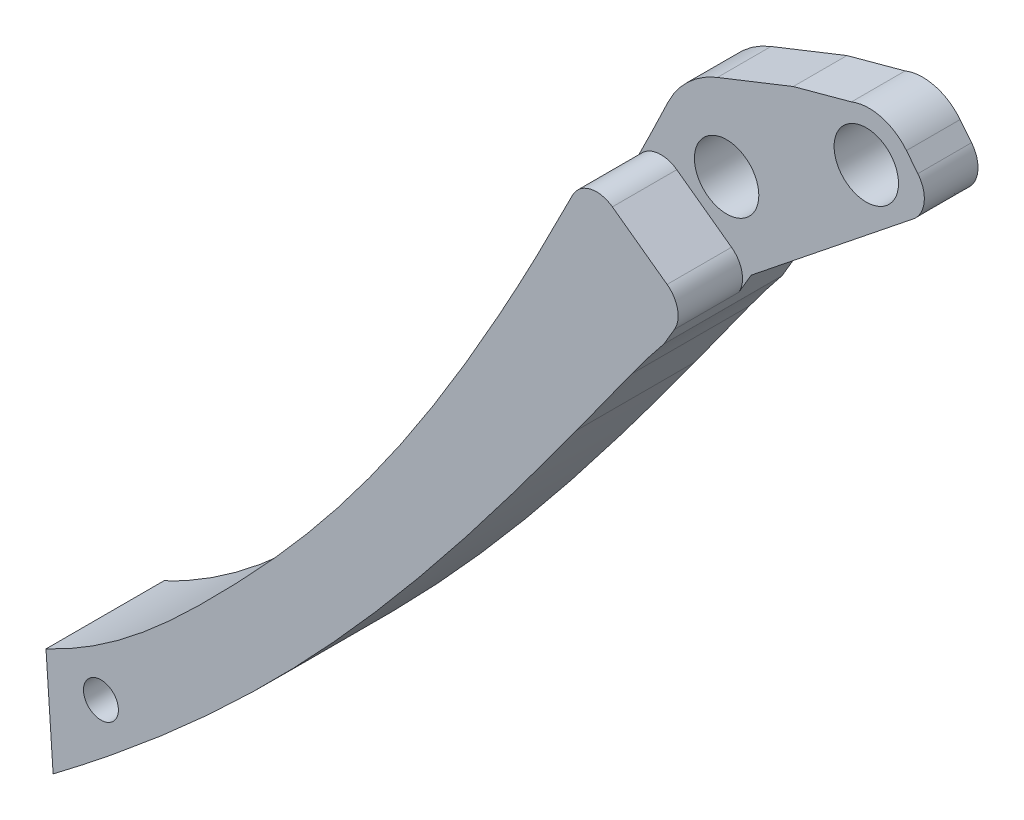
from build123d import *

# Parameters (mm, degrees)
SKETCH_1_R              = 3.25
SKETCH_1_R_2            = 2.6
SKETCH_1_R_3            = 6
EXTRUDE_1_DEPTH         = 22
CUT_EXTRUDE_START       = -12
CUT_EXTRUDE_1_OUTLINE_R = 6
CUT_EXTRUDE_1_DEPTH     = 12
FILLET_1_R              = 5


# Read off the part's stored shape, not the designer's step: 切除-拉伸1
with BuildPart() as part:
    # 草图1 → 凸台-拉伸1 (new body)
    # profile 1 of 5: a face of its own
    with BuildSketch(Plane.XY):
        with BuildLine():
            add(Edge.make_bspline(
                [(24.246770742, 21.941390991), (24.048583333, 21.634147277), (23.849915374, 21.32721218), (19.701623041, 14.940432485), (15.559132392, 8.986031396), (8.996184749, 0.316151178), (6.750767703, -2.530392197), (2.144057051, -8.127411356), (-0.217808171, -10.878282604), (-5.046422661, -16.285033431), (-7.513766191, -18.941614921), (-11.275529005, -22.867124427), (-12.539552784, -24.166218208), (-15.083673792, -26.748249579), (-16.36301535, -28.031904747), (-20.240592162, -31.842886453), (-22.879147648, -34.331371146), (-28.34991894, -39.09038887), (-31.182503177, -41.360621491), (-37.102725457, -45.547224242), (-40.191371338, -47.46215102), (-44.265140387, -49.576428538), (-45.130202316, -50.003144372), (-46.003788403, -50.411640151)],
                knots=[0.243696274, 0.243696274, 0.243696274, 0.243696274, 0.25, 0.25, 0.375, 0.375, 0.4375, 0.4375, 0.5, 0.5, 0.5625, 0.5625, 0.59375, 0.59375, 0.625, 0.625, 0.6875, 0.6875, 0.75, 0.75, 0.8125, 0.8125, 0.829122533, 0.829122533, 0.829122533, 0.829122533], degree=3))
            Line((-46.003788403, -50.411640151), (-44.676128402, -69.924811579))
            add(Edge.make_bspline(
                [(-44.676128402, -69.924811579), (-42.354879029, -68.173560917), (-40.052239479, -66.397657245), (-31.894879431, -59.96761332), (-26.146670204, -55.177399813), (-14.945706379, -45.263165822), (-9.496217193, -40.135747192), (1.08076509, -29.558238094), (6.20766625, -24.108720133), (16.162933512, -12.943513517), (20.991776432, -7.229875688), (25.744132469, -1.370589693), (25.785083216, -1.320082664), (25.826025181, -1.269568576)],
                knots=[0.201401882, 0.201401882, 0.201401882, 0.201401882, 0.25, 0.25, 0.375, 0.375, 0.5, 0.5, 0.625, 0.625, 0.75, 0.75, 0.751086715, 0.751086715, 0.751086715, 0.751086715], degree=3))
            Line((25.826025181, -1.269568576), (24.246770742, 21.941390991))
        make_face()
        with Locations((-35.768456318, -53.530610672)):
            Circle(SKETCH_1_R, mode=Mode.SUBTRACT)
        with Locations((15.866025181, -2.197268261)):
            Circle(SKETCH_1_R_2, mode=Mode.SUBTRACT)
    # profile 2 of 5: a face of its own
    with BuildSketch(Plane.XY):
        with BuildLine():
            add(Edge.make_bspline(
                [(45.404726147, 58.671213746), (42.047127081, 52.245521431), (38.580985934, 45.876195201), (31.539947217, 33.621328764), (27.978549031, 27.726649652), (24.246770742, 21.941390991)],
                knots=[0, 0, 0, 0, 0.125, 0.125, 0.243696274, 0.243696274, 0.243696274, 0.243696274], degree=3))
            Line((24.246770742, 21.941390991), (25.826025181, -1.269568576))
            add(Edge.make_bspline(
                [(25.826025181, -1.269568576), (30.494456483, 4.490329629), (35.048700318, 10.341994574), (44.040548072, 22.214968329), (48.477031458, 28.236694951), (52.867792665, 34.291262241)],
                knots=[0.751086715, 0.751086715, 0.751086715, 0.751086715, 0.875, 0.875, 1, 1, 1, 1], degree=3))
            add(Edge.make_bspline(
                [(52.867792665, 34.291262241), (54.585283978, 36.659627804), (56.295592698, 39.033185186), (58.853283121, 42.599078019), (59.703592022, 43.78931812), (61.406400696, 46.168192958), (62.260286954, 47.355980663), (63.122866854, 48.537325445)],
                knots=[0, 0, 0, 0, 12.867122322, 12.867122322, 19.300683483, 19.300683483, 25.734244644, 25.734244644, 25.734244644, 25.734244644], degree=3))
            add(Edge.make_bspline(
                [(63.122866854, 48.537325445), (63.890744988, 49.593267388), (64.585452359, 50.528608986), (65.352581075, 51.561457391), (66.069819365, 52.500349083), (66.843747115, 53.513449395), (67.582253438, 54.446906012), (68.368786288, 55.441067159), (69.129081757, 56.362602713)],
                knots=[0, 0, 0, 0.25, 0.25, 0.5, 0.5, 0.75, 0.75, 1, 1, 1], degree=2))
            add(Edge.make_bspline(
                [(69.129081757, 56.362602713), (69.139522727, 56.376913703), (69.148757762, 56.392240586)],
                knots=[0.088106579, 0.088106579, 0.088106579, 0.143786066, 0.143786066, 0.143786066], degree=2, weights=[1, 0.999612499, 1]))
            Line((69.148757762, 56.392240586), (73.382245675, 63.58271012))
            Line((73.382245675, 63.58271012), (77.876207201, 67.17962487))
            ThreePointArc((77.876207201, 67.17962487), (78.579681997, 67.75128437), (79.291554354, 68.312452009))
            Line((79.291554354, 68.312452009), (103.568478661, 87.743421018))
            add(Edge.make_bspline(
                [(103.568478661, 87.743421018), (103.994628114, 88.083498112), (104.345634722, 88.500209303), (104.695525149, 88.915595377), (104.957299334, 89.390611784), (105.219500218, 89.866402479), (105.383592342, 90.383514181), (105.547318736, 90.89947334), (105.607505586, 91.436682712), (105.668086664, 91.977410832), (105.621882906, 92.518813243), (105.575885152, 93.057801763), (105.42622846, 93.576866403), (105.275581378, 94.099366077), (105.026118045, 94.581721125), (104.777104509, 95.06320646), (104.439328041, 95.486702432)],
                knots=[0, 0, 0, 0.125, 0.125, 0.25, 0.25, 0.375, 0.375, 0.5, 0.5, 0.625, 0.625, 0.75, 0.75, 0.875, 0.875, 1, 1, 1], degree=2))
            Line((104.439328041, 95.486702432), (102.307586872, 98.150082549))
            add(Edge.make_bspline(
                [(102.307586872, 98.150082549), (101.862375224, 98.707408746), (101.334531123, 99.186660834), (100.805502223, 99.666988651), (100.207413759, 100.056631193), (99.613514937, 100.443544268), (98.966666499, 100.73157288), (98.315158157, 101.021676452), (97.626563394, 101.204456829), (96.940928319, 101.386451586), (96.235887337, 101.457788474), (95.5271128, 101.529503128), (94.816673312, 101.487928839), (94.107671317, 101.446438671), (93.414871079, 101.29350915), (92.720461504, 101.140224382), (92.05942378, 100.879055504)],
                knots=[0, 0, 0, 0.125, 0.125, 0.25, 0.25, 0.375, 0.375, 0.5, 0.5, 0.625, 0.625, 0.75, 0.75, 0.875, 0.875, 1, 1, 1], degree=2))
            Line((92.05942378, 100.879055504), (81.22237845, 97.937140274))
            Line((81.22237845, 97.937140274), (67.079727927, 92.33227511))
            add(Edge.make_bspline(
                [(67.079727927, 92.33227511), (65.57369205, 91.735592871), (64.205503362, 90.868278931), (62.846038888, 90.006495393), (61.670020717, 88.907497765), (60.492066487, 87.806690876), (59.539142576, 86.506195587), (58.582788417, 85.201018894), (57.886553249, 83.740417625)],
                knots=[0, 0, 0, 0.25, 0.25, 0.5, 0.5, 0.75, 0.75, 1, 1, 1], degree=2))
            add(Edge.make_bspline(
                [(57.886553249, 83.740417625), (56.295263332, 80.401632953), (54.718298589, 77.162280014)],
                knots=[0, 0, 0, 1, 1, 1], degree=2))
            add(Edge.make_bspline(
                [(54.718298587, 77.16228001), (53.962984736, 75.610969124), (53.199460737, 74.063699918), (51.667234132, 70.971710824), (50.897006164, 69.427763472), (49.346278683, 66.345016372), (48.565990794, 64.806128721), (46.994344366, 61.734063386), (46.203661055, 60.200522912), (45.404726147, 58.671213746)],
                knots=[0, 0, 0, 0, 0.25, 0.25, 0.5, 0.5, 0.75, 0.75, 1, 1, 1, 1], degree=3))
        make_face()
        with Locations((33.346770742, 20.777472123)):
            Circle(SKETCH_1_R_2, mode=Mode.SUBTRACT)
        with Locations((57.369550076, 58.366266824)):
            Circle(SKETCH_1_R_2, mode=Mode.SUBTRACT)
        with Locations((68.802392599, 77.162280014)):
            Circle(SKETCH_1_R_3, mode=Mode.SUBTRACT)
        with Locations((94.825274675, 92.089088396)):
            Circle(SKETCH_1_R_3, mode=Mode.SUBTRACT)
    # profile 3 of 5: a face of its own
    with BuildSketch(Plane.XY):
        with Locations((15.866025181, -2.197268261)):
            Circle(SKETCH_1_R_2)
    # profile 4 of 5: a face of its own
    with BuildSketch(Plane.XY):
        with Locations((33.346770742, 20.777472123)):
            Circle(SKETCH_1_R_2)
    # profile 5 of 5: a face of its own
    with BuildSketch(Plane.XY):
        with Locations((57.369550076, 58.366266824)):
            Circle(SKETCH_1_R_2)
    extrude(amount=EXTRUDE_1_DEPTH)

    # 切除-拉伸1 outline → 切除-拉伸1 (cut)
    with BuildSketch(Plane.XY.offset(22).offset(CUT_EXTRUDE_START)):
        with BuildLine():
            add(Edge.make_bspline(
                [(57.886553248, 83.740417623), (56.295263332, 80.401632954), (54.71829859, 77.162280016)],
                knots=[0.494428836, 0.494428836, 0.494428836, 0.494587311, 0.494587311, 0.494587311], degree=2))
            Line((54.71829859, 77.162280016), (73.382245675, 63.58271012))
            Line((73.382245675, 63.58271012), (77.876207201, 67.17962487))
            ThreePointArc((77.876207201, 67.17962487), (78.579681997, 67.75128437), (79.291554354, 68.312452009))
            Line((79.291554354, 68.312452009), (103.568478661, 87.743421018))
            add(Edge.make_bspline(
                [(103.568478661, 87.743421018), (103.994628114, 88.083498112), (104.345634722, 88.500209303), (104.695525149, 88.915595377), (104.957299334, 89.390611784), (105.219500218, 89.866402479), (105.383592342, 90.383514181), (105.547318736, 90.89947334), (105.607505586, 91.436682712), (105.668086664, 91.977410832), (105.621882906, 92.518813243), (105.575885152, 93.057801763), (105.42622846, 93.576866403), (105.275581378, 94.099366077), (105.026118045, 94.581721125), (104.777104509, 95.06320646), (104.439328041, 95.486702432)],
                knots=[0, 0, 0, 0.125, 0.125, 0.25, 0.25, 0.375, 0.375, 0.5, 0.5, 0.625, 0.625, 0.75, 0.75, 0.875, 0.875, 1, 1, 1], degree=2))
            Line((104.439328041, 95.486702432), (102.307586872, 98.150082549))
            add(Edge.make_bspline(
                [(102.307586872, 98.150082549), (101.862375224, 98.707408746), (101.334531123, 99.186660834), (100.805502223, 99.666988651), (100.207413759, 100.056631193), (99.613514937, 100.443544268), (98.966666499, 100.73157288), (98.315158157, 101.021676452), (97.626563394, 101.204456829), (96.940928319, 101.386451586), (96.235887337, 101.457788474), (95.5271128, 101.529503128), (94.816673312, 101.487928839), (94.107671317, 101.446438671), (93.414871079, 101.29350915), (92.720461504, 101.140224382), (92.05942378, 100.879055504)],
                knots=[0, 0, 0, 0.125, 0.125, 0.25, 0.25, 0.375, 0.375, 0.5, 0.5, 0.625, 0.625, 0.75, 0.75, 0.875, 0.875, 1, 1, 1], degree=2))
            Line((92.05942378, 100.879055504), (81.22237845, 97.937140274))
            Line((81.22237845, 97.937140274), (67.079727927, 92.33227511))
            add(Edge.make_bspline(
                [(67.079727927, 92.33227511), (65.57369205, 91.735592871), (64.205503362, 90.868278931), (62.846038888, 90.006495393), (61.670020717, 88.907497765), (60.492066487, 87.806690876), (59.539142576, 86.506195587), (58.582788417, 85.201018894), (57.886553248, 83.740417623)],
                knots=[0, 0, 0, 0.25, 0.25, 0.5, 0.5, 0.75, 0.75, 1, 1, 1], degree=2))
        make_face()
        with Locations((68.802392599, 77.162280014)):
            Circle(CUT_EXTRUDE_1_OUTLINE_R, mode=Mode.SUBTRACT)
        with Locations((94.825274675, 92.089088396)):
            Circle(CUT_EXTRUDE_1_OUTLINE_R, mode=Mode.SUBTRACT)
    extrude(amount=CUT_EXTRUDE_1_DEPTH, mode=Mode.SUBTRACT)

    # 圆角1
    fillet_1_edges = [part.edges().sort_by_distance(p)[0] for p in [
        (73.382245675, 63.58271012, 16),
    ]]
    fillet(fillet_1_edges, radius=FILLET_1_R)
    # the kernel refuses this fillet: 5 mm, written as the material it takes off along each edge
    with BuildSketch(Plane(origin=(54.718298588, 77.162280012, 10), x_dir=(0.8086167397348055, -0.5883357614667443, 0), z_dir=(0, 0, 1))) as fillet_1_2_piece_1:
        with BuildLine():
            CenterArc((5.939761684, -5), FILLET_1_R, 89.99999996, 99.633547554)
            Line((1.010270571, -5.836730166), (0.911680749, -5.853464769))
            ThreePointArc((0.911680749, -5.853464769), (0.412045153, -2.93444201), (-0.098457006, -0.017499087))
            Line((-0.098457006, -0.017499087), (0, 0.1))
            Line((0, 0.1), (5.939761688, 0.1))
            Line((5.939761688, 0.1), (5.939761688, 0))
        make_face()
    extrude(amount=26.849404219, mode=Mode.SUBTRACT)


solid = part.part
